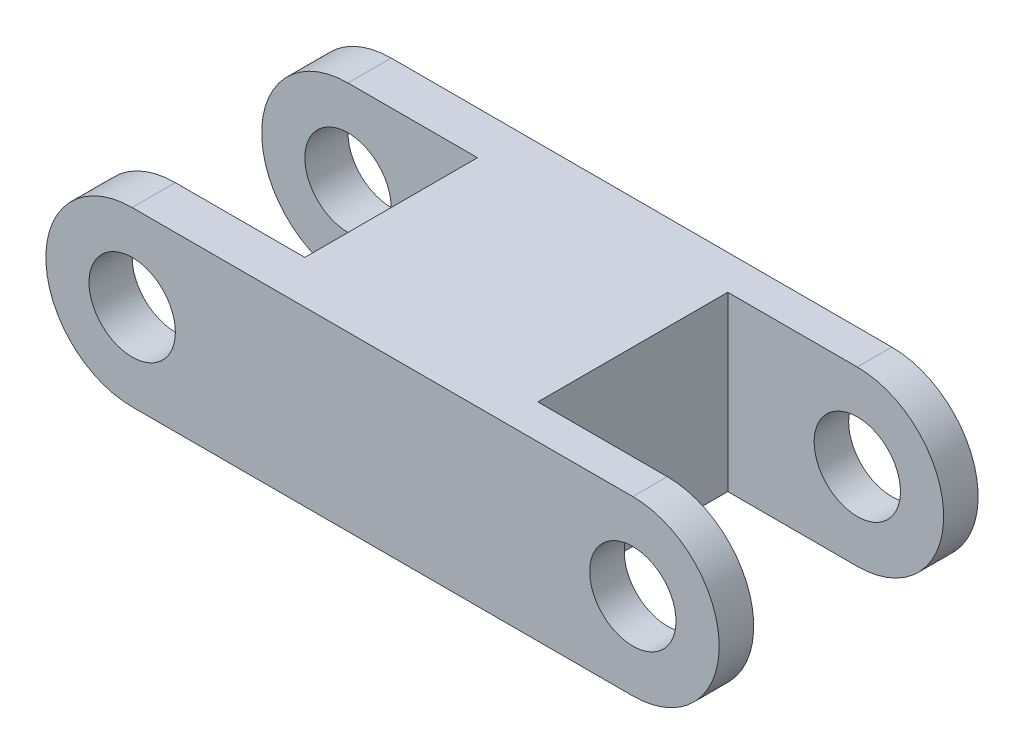
from build123d import *

# Parameters (mm, degrees)
SKETCH1_R           = 5
BOSS_EXTRUDE1_DEPTH = 30
SKETCH2_W           = 25
SKETCH2_H           = 20
SKETCH2_H_2         = 22
CUT_EXTRUDE1_DEPTH  = 77.962109955


with BuildPart() as part:
    # Sketch1 → Boss-Extrude1 (new body)
    with BuildSketch(Plane.XY):
        with BuildLine():
            Line((0, 10), (57.993870082, 10))
            ThreePointArc((57.993870082, 10), (67.993870082, 0), (57.993870082, -10))
            Line((57.993870082, -10), (0, -10))
            ThreePointArc((0, -10), (-10, 0), (0, 10))
        make_face()
        Circle(SKETCH1_R, mode=Mode.SUBTRACT)
        with Locations((57.993870082, 0)):
            Circle(SKETCH1_R, mode=Mode.SUBTRACT)
    extrude(amount=BOSS_EXTRUDE1_DEPTH)

    # Sketch2 → Cut-Extrude1 (cut, through all)
    with BuildSketch(Plane(origin=(0, 10, 0), x_dir=(1, 0, 0), z_dir=(0, 1, 0))):
        with Locations((2.5, -15)):
            Rectangle(SKETCH2_W, SKETCH2_H)
        with Locations((55.493870082, -15)):
            Rectangle(SKETCH2_W, SKETCH2_H_2)
    extrude(amount=-CUT_EXTRUDE1_DEPTH, mode=Mode.SUBTRACT)


solid = part.part
